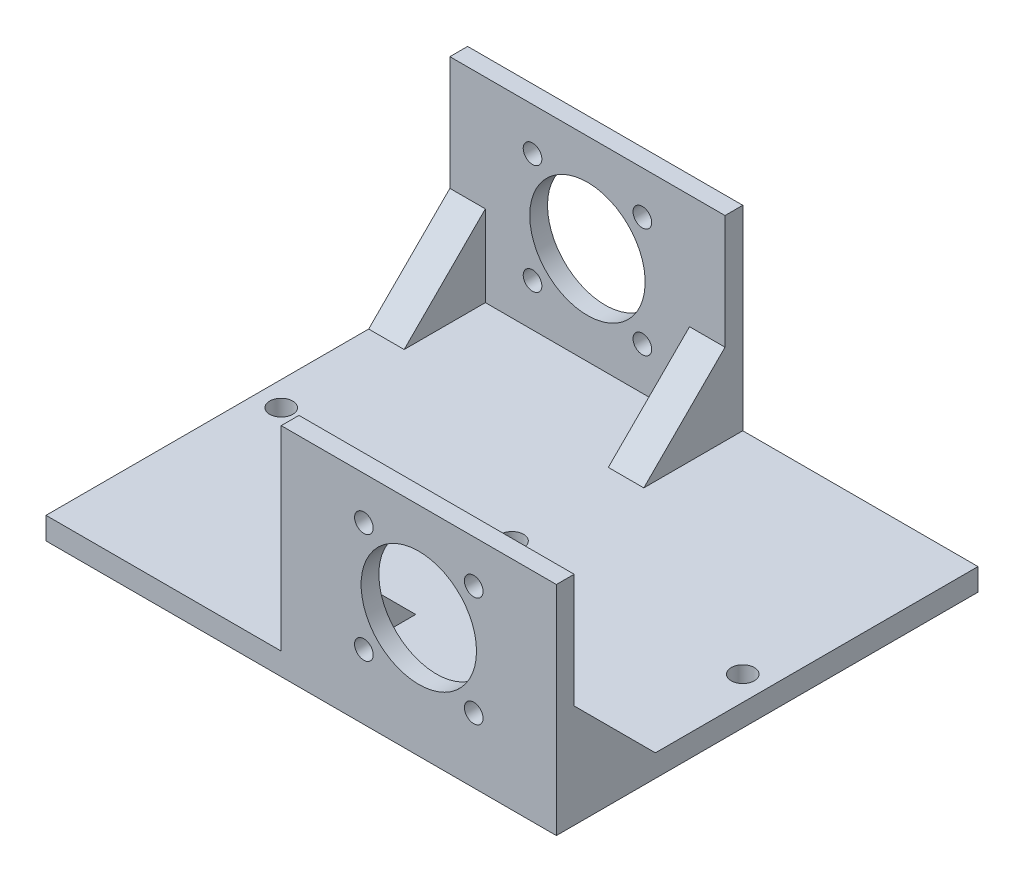
from build123d import *

# Parameters (mm, degrees)
SKETCH2_W           = 115
SKETCH2_H           = 95
BOSS_EXTRUDE1_DEPTH = 5
SKETCH3_W           = 62
SKETCH3_H           = 4
BOSS_EXTRUDE2_DEPTH = 44
RIB1_REACH          = 135.725
SKETCH5_WALL_W      = 295.338836254
SKETCH5_WALL_H      = 8
RIB2_REACH          = 94.202
SKETCH6_WALL_W      = 212.294222484
SKETCH6_WALL_H      = 8
RIB6_REACH          = 135.725
SKETCH7_WALL_W      = 295.32906057
SKETCH7_WALL_H      = 8
BOSS_EXTRUDE3_DEPTH = 8
SKETCH11_R          = 13
SKETCH11_R_2        = 2.1
CUT_EXTRUDE1_DEPTH  = 4
SKETCH12_R          = 13
SKETCH12_R_2        = 2.1
CUT_EXTRUDE2_DEPTH  = 4
SKETCH13_R          = 2.6
CUT_EXTRUDE3_DEPTH  = 5


with BuildPart() as part:
    # Sketch2 → Boss-Extrude1 (new body)
    with BuildSketch(Plane(origin=(0, 0, 0), x_dir=(1, 0, 0), z_dir=(0, 1, 0))):
        Rectangle(SKETCH2_W, SKETCH2_H)
    extrude(amount=BOSS_EXTRUDE1_DEPTH)

    # Sketch3 → Boss-Extrude2 (add)
    with BuildSketch(Plane(origin=(0, 5, 0), x_dir=(1, 0, 0), z_dir=(0, 1, 0))):
        with Locations((-26.5, 45.5)):
            Rectangle(SKETCH3_W, SKETCH3_H)
        with Locations((26.5, -45.5)):
            Rectangle(SKETCH3_W, SKETCH3_H)
    extrude(amount=BOSS_EXTRUDE2_DEPTH)

    # Sketch5 wall → Rib1 (add, up to next)
    with BuildSketch(Plane(origin=(57.5, 14.153417974, 34.346582025), x_dir=(0, -0.707106781187, -0.707106781187), z_dir=(0, 0.707106781187, -0.707106781187)), mode=Mode.PRIVATE) as rib1_sk1:
        with Locations((0, 4)):
            Rectangle(SKETCH5_WALL_W, SKETCH5_WALL_H)
    rib1_tool1 = extrude(rib1_sk1.sketch, amount=-RIB1_REACH, mode=Mode.PRIVATE) - part.part
    add(rib1_tool1.solids().sort_by_distance((57.5, 14.153417974, 34.346582025))[0])

    # Sketch6 wall → Rib2 (add, up to next)
    with BuildSketch(Plane(origin=(-4.5, 14.153417974, 34.346582025), x_dir=(0, 0.707106781187, 0.707106781187), z_dir=(0, 0.707106781187, -0.707106781187)), mode=Mode.PRIVATE) as rib2_sk1:
        with Locations((0, 4)):
            Rectangle(SKETCH6_WALL_W, SKETCH6_WALL_H)
    rib2_tool1 = extrude(rib2_sk1.sketch, amount=-RIB2_REACH, mode=Mode.PRIVATE) - part.part
    add(rib2_tool1.solids().sort_by_distance((-4.5, 14.153417974, 34.346582025))[0])

    # Sketch7 wall → Rib6 (add, up to next)
    with BuildSketch(Plane(origin=(-57.5, 14.149961749, -34.350038251), x_dir=(0, -0.707106781187, 0.707106781187), z_dir=(0, 0.707106781187, 0.707106781187)), mode=Mode.PRIVATE) as rib6_sk1:
        with Locations((0, 4)):
            Rectangle(SKETCH7_WALL_W, SKETCH7_WALL_H)
    rib6_tool1 = extrude(rib6_sk1.sketch, amount=-RIB6_REACH, mode=Mode.PRIVATE) - part.part
    add(rib6_tool1.solids().sort_by_distance((-57.5, 14.149961749, -34.350038251))[0])

    # Sketch9 → Boss-Extrude3 (add)
    with BuildSketch(Plane(origin=(4.5, 0, 0), x_dir=(0, 0, -1), z_dir=(1, 0, 0))):
        Polygon((43.5, 23.299923497), (25.200076503, 5), (43.5, 5), align=None)
    extrude(amount=-BOSS_EXTRUDE3_DEPTH)

    # Sketch11 → Cut-Extrude1 (cut)
    with BuildSketch(Plane(origin=(0, 0, -47.5), x_dir=(-1, 0, 0), z_dir=(0, 0, -1))):
        with Locations((26.5, 27)):
            Circle(SKETCH11_R)
        with Locations((38.874368671, 39.374368671)):
            Circle(SKETCH11_R_2)
        with Locations((38.874368671, 14.625631329)):
            Circle(SKETCH11_R_2)
        with Locations((14.125631329, 14.625631329)):
            Circle(SKETCH11_R_2)
        with Locations((14.125631329, 39.374368671)):
            Circle(SKETCH11_R_2)
    extrude(amount=-CUT_EXTRUDE1_DEPTH, mode=Mode.SUBTRACT)

    # Sketch12 → Cut-Extrude2 (cut)
    with BuildSketch(Plane.XY.offset(47.5)):
        with Locations((26.5, 27)):
            Circle(SKETCH12_R)
        with Locations((38.874368671, 39.374368671)):
            Circle(SKETCH12_R_2)
        with Locations((38.874368671, 14.625631329)):
            Circle(SKETCH12_R_2)
        with Locations((14.125631329, 14.625631329)):
            Circle(SKETCH12_R_2)
        with Locations((14.125631329, 39.374368671)):
            Circle(SKETCH12_R_2)
    extrude(amount=-CUT_EXTRUDE2_DEPTH, mode=Mode.SUBTRACT)

    # Sketch13 → Cut-Extrude3 (cut)
    with BuildSketch(Plane(origin=(0, 5, 0), x_dir=(1, 0, 0), z_dir=(0, 1, 0))):
        Circle(SKETCH13_R)
        with Locations((52, 0)):
            Circle(SKETCH13_R)
        with Locations((-52, 0)):
            Circle(SKETCH13_R)
    extrude(amount=-CUT_EXTRUDE3_DEPTH, mode=Mode.SUBTRACT)


solid = part.part
